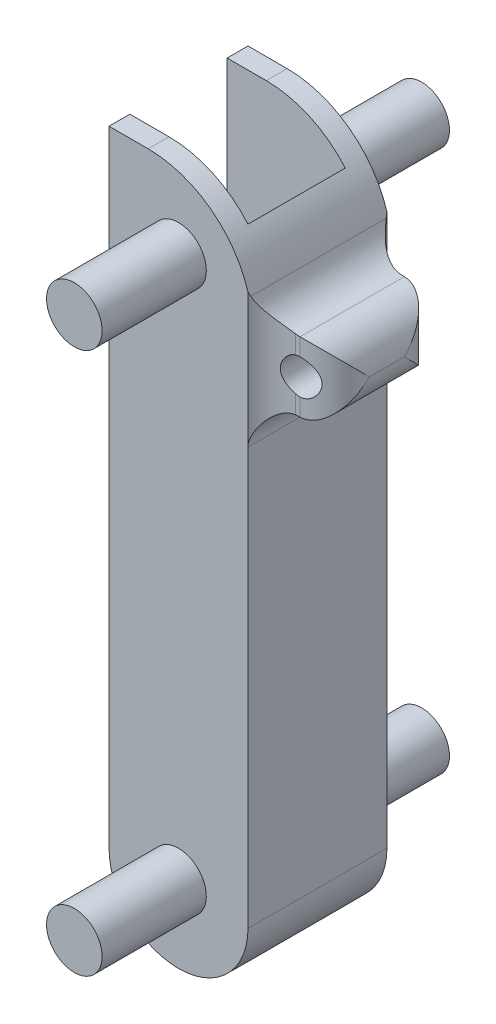
from build123d import *

# Parameters (mm, degrees)
SKETCH1_W               = 20
SKETCH1_H               = 100
BOSS_EXTRUDE1_DEPTH     = 10
SKETCH3_R               = 4
BOSS_EXTRUDE2_DEPTH     = 25
FILLET1_R               = 10
SKETCH5_W               = 10
SKETCH5_H               = 10
SKETCH5_R               = 2.5
BOSS_EXTRUDE3_DEPTH     = 7.5
FILLET2_R               = 5
CUT_EXTRUDE1_DEPTH      = 106.000000019
CUT_EXTRUDE1_DEPTH_BACK = 106.000000019
SKETCH6_W               = 17
SKETCH6_H               = 14
FILLET3_R               = 15


# Some blends are built 0.0001 mm under size
with BuildPart() as part:
    # Sketch1 → Boss-Extrude1 (new, symmetric)
    with BuildSketch(Plane(origin=(0, 0, 0), x_dir=(0, 0, -1), z_dir=(1, 0, 0))):
        with Locations((0, 50)):
            Rectangle(SKETCH1_W, SKETCH1_H)
    extrude(amount=BOSS_EXTRUDE1_DEPTH, both=True)

    # Sketch3 → Boss-Extrude2 (add, symmetric)
    with BuildSketch(Plane.XY):
        with Locations(Location((0, 11, 0), (0, 0, 270))):
            Circle(SKETCH3_R)
        with Locations(Location((0, 89, 0), (0, 0, 270))):
            Circle(SKETCH3_R)
    extrude(amount=BOSS_EXTRUDE2_DEPTH, both=True)

    # Fillet1
    fillet1_edges = [part.edges().sort_by_distance(p)[0] for p in [
        (10, 0, 0),
        (-10, 0, 0),
    ]]
    fillet(fillet1_edges, radius=FILLET1_R - 0.0001)  # a hair under: the kernel refuses the full size

    # Sketch5 → Boss-Extrude3 (add, symmetric)
    with BuildSketch(Plane.XY):
        with Locations((15, 80)):
            Rectangle(SKETCH5_W, SKETCH5_H)
        with Locations((15, 80)):
            Circle(SKETCH5_R, mode=Mode.SUBTRACT)
    extrude(amount=BOSS_EXTRUDE3_DEPTH, both=True)

    # Fillet2
    # the kernel refuses this fillet: 5 mm, written as the material it takes off along each edge
    with BuildSketch(Plane(origin=(20, 97.5, 7.5), x_dir=(-1, 0, 0), z_dir=(0, -1, 0))) as fillet2_piece_1:
        with BuildLine():
            CenterArc((FILLET2_R, FILLET2_R), FILLET2_R, 180, 90)
            Line((0, FILLET2_R), (0, 0))
            Line((0, 0), (FILLET2_R, 0))
        make_face()
    extrude(amount=35, mode=Mode.SUBTRACT)
    with BuildSketch(Plane(origin=(20, 97.5, -7.5), x_dir=(-1, 0, 0), z_dir=(0, -1, 0))) as fillet2_piece_2:
        with BuildLine():
            CenterArc((FILLET2_R, -FILLET2_R), FILLET2_R, 90, 90)
            Line((0, -FILLET2_R), (0, 0))
            Line((0, 0), (FILLET2_R, 0))
        make_face()
    extrude(amount=35, mode=Mode.SUBTRACT)
    with BuildSketch(Plane(origin=(20, 75, 20), x_dir=(-1, 0, 0), z_dir=(0, 0, -1))) as fillet2_piece_3:
        with BuildLine():
            CenterArc((FILLET2_R, FILLET2_R), FILLET2_R, 180, 90)
            Line((0, FILLET2_R), (0, 0))
            Line((0, 0), (FILLET2_R, 0))
        make_face()
    extrude(amount=40, mode=Mode.SUBTRACT)
    with BuildSketch(Plane(origin=(20, 85, 20), x_dir=(-1, 0, 0), z_dir=(0, 0, -1))) as fillet2_piece_4:
        with BuildLine():
            CenterArc((FILLET2_R, -FILLET2_R), FILLET2_R, 90, 90)
            Line((0, -FILLET2_R), (0, 0))
            Line((0, 0), (FILLET2_R, 0))
        make_face()
    extrude(amount=40, mode=Mode.SUBTRACT)
    # the kernel refuses this fillet: 5 mm, written as the material it adds along each edge
    with BuildSketch(Plane(origin=(10, 75, 7.5), x_dir=(0, 0, 1), z_dir=(0, 1, 0))) as fillet2_2_piece_1_section:
        with BuildLine():
            CenterArc((5, 4.330127019), FILLET2_R, 180, 60)
            Line((0, 4.330127019), (0, 0))
            Line((0, 0), (2.5, 0))
        make_face()
    fillet2_2_piece_1 = extrude(amount=10, mode=Mode.PRIVATE)
    fillet2_2_piece_1 = fillet2_2_piece_1 - Plane(origin=(15, 80, 7.5), x_dir=(1, 0, 0), z_dir=(0, 0, -1)) * Cylinder(2.5, 38, mode=Mode.PRIVATE)
    add(fillet2_2_piece_1)
    with BuildSketch(Plane(origin=(10, 75, -7.5), x_dir=(0, 0, -1), z_dir=(0, 1, 0))) as fillet2_2_piece_2_section:
        with BuildLine():
            CenterArc((5, -4.330127019), FILLET2_R, 120, 60)
            Line((0, -4.330127019), (0, 0))
            Line((0, 0), (2.5, 0))
        make_face()
    fillet2_2_piece_2 = extrude(amount=10, mode=Mode.PRIVATE)
    fillet2_2_piece_2 = fillet2_2_piece_2 - Plane(origin=(15, 80, -7.5), x_dir=(1, 0, 0), z_dir=(0, 0, -1)) * Cylinder(2.5, 38, mode=Mode.PRIVATE)
    add(fillet2_2_piece_2)
    with BuildSketch(Plane(origin=(10, 85, -7.5), x_dir=(0, 1, 0), z_dir=(0, 0, 1))) as fillet2_2_piece_3:
        with BuildLine():
            CenterArc((FILLET2_R, -FILLET2_R), FILLET2_R, 90, 90)
            Line((0, -FILLET2_R), (0, 0))
            Line((0, 0), (FILLET2_R, 0))
        make_face()
    extrude(amount=15)
    with BuildSketch(Plane(origin=(10, 75, -7.5), x_dir=(0, -1, 0), z_dir=(0, 0, 1))) as fillet2_2_piece_4:
        with BuildLine():
            CenterArc((FILLET2_R, FILLET2_R), FILLET2_R, 180, 90)
            Line((0, FILLET2_R), (0, 0))
            Line((0, 0), (FILLET2_R, 0))
        make_face()
    extrude(amount=15)
    with BuildSketch(Plane(origin=(10, 64.174682453, 7.5), x_dir=(0, 0, 1), z_dir=(0, 1, 0))) as fillet2_2_piece_5a_section:
        with BuildLine():
            CenterArc((5, 4.330127019), FILLET2_R, 180, 60)
            Line((0, 4.330127019), (0, 0))
            Line((0, 0), (2.5, 0))
        make_face()
    fillet2_2_piece_5a = extrude(amount=20.825317547, mode=Mode.PRIVATE)
    fillet2_2_piece_5a = split(fillet2_2_piece_5a, bisect_by=Plane(origin=(10, 75, 7.5), z_dir=(0, -1, 0)), keep=Keep.TOP, mode=Mode.PRIVATE)
    with BuildSketch(Plane(origin=(10, 75, -7.5), x_dir=(0, -1, 0), z_dir=(0, 0, 1))) as fillet2_2_piece_5b_section:
        with BuildLine():
            CenterArc((FILLET2_R, FILLET2_R), FILLET2_R, 180, 90)
            Line((0, FILLET2_R), (0, 0))
            Line((0, 0), (FILLET2_R, 0))
        make_face()
    fillet2_2_piece_5b = extrude(amount=27.5, mode=Mode.PRIVATE)
    fillet2_2_piece_5b = split(fillet2_2_piece_5b, bisect_by=Plane(origin=(10, 75, 10), z_dir=(0, 0, -1)), keep=Keep.TOP, mode=Mode.PRIVATE)
    fillet2_2_piece_5b = split(fillet2_2_piece_5b, bisect_by=Plane(origin=(10, 75, 7.5), z_dir=(0, 0, 1)), keep=Keep.TOP, mode=Mode.PRIVATE)
    fillet2_2_piece_5 = fillet2_2_piece_5a & fillet2_2_piece_5b
    add(fillet2_2_piece_5)
    with BuildSketch(Plane(origin=(10, 85, -7.5), x_dir=(0, 1, 0), z_dir=(0, 0, 1))) as fillet2_2_piece_6a_section:
        with BuildLine():
            CenterArc((FILLET2_R, -FILLET2_R), FILLET2_R, 90, 90)
            Line((0, -FILLET2_R), (0, 0))
            Line((0, 0), (FILLET2_R, 0))
        make_face()
    fillet2_2_piece_6a = extrude(amount=27.5, mode=Mode.PRIVATE)
    fillet2_2_piece_6a = split(fillet2_2_piece_6a, bisect_by=Plane(origin=(10, 85, 10), z_dir=(0, 0, -1)), keep=Keep.TOP, mode=Mode.PRIVATE)
    fillet2_2_piece_6a = split(fillet2_2_piece_6a, bisect_by=Plane(origin=(10, 85, 7.5), z_dir=(0, 0, 1)), keep=Keep.TOP, mode=Mode.PRIVATE)
    with BuildSketch(Plane(origin=(10, 75, 7.5), x_dir=(0, 0, 1), z_dir=(0, 1, 0))) as fillet2_2_piece_6b_section:
        with BuildLine():
            CenterArc((5, 4.330127019), FILLET2_R, 180, 60)
            Line((0, 4.330127019), (0, 0))
            Line((0, 0), (2.5, 0))
        make_face()
    fillet2_2_piece_6b = extrude(amount=20.825317547, mode=Mode.PRIVATE)
    fillet2_2_piece_6b = split(fillet2_2_piece_6b, bisect_by=Plane(origin=(10, 85, 7.5), z_dir=(0, 1, 0)), keep=Keep.TOP, mode=Mode.PRIVATE)
    fillet2_2_piece_6 = fillet2_2_piece_6a & fillet2_2_piece_6b
    add(fillet2_2_piece_6)
    with BuildSketch(Plane(origin=(10, 75, -20), x_dir=(0, -1, 0), z_dir=(0, 0, 1))) as fillet2_2_piece_7a_section:
        with BuildLine():
            CenterArc((FILLET2_R, FILLET2_R), FILLET2_R, 180, 90)
            Line((0, FILLET2_R), (0, 0))
            Line((0, 0), (FILLET2_R, 0))
        make_face()
    fillet2_2_piece_7a = extrude(amount=27.5, mode=Mode.PRIVATE)
    fillet2_2_piece_7a = split(fillet2_2_piece_7a, bisect_by=Plane(origin=(10, 75, -10), z_dir=(0, 0, 1)), keep=Keep.TOP, mode=Mode.PRIVATE)
    fillet2_2_piece_7a = split(fillet2_2_piece_7a, bisect_by=Plane(origin=(10, 75, -7.5), z_dir=(0, 0, -1)), keep=Keep.TOP, mode=Mode.PRIVATE)
    with BuildSketch(Plane(origin=(10, 64.174682453, -7.5), x_dir=(0, 0, -1), z_dir=(0, 1, 0))) as fillet2_2_piece_7b_section:
        with BuildLine():
            CenterArc((5, -4.330127019), FILLET2_R, 120, 60)
            Line((0, -4.330127019), (0, 0))
            Line((0, 0), (2.5, 0))
        make_face()
    fillet2_2_piece_7b = extrude(amount=20.825317547, mode=Mode.PRIVATE)
    fillet2_2_piece_7b = split(fillet2_2_piece_7b, bisect_by=Plane(origin=(10, 75, -7.5), z_dir=(0, -1, 0)), keep=Keep.TOP, mode=Mode.PRIVATE)
    fillet2_2_piece_7 = fillet2_2_piece_7a & fillet2_2_piece_7b
    add(fillet2_2_piece_7)
    with BuildSketch(Plane(origin=(10, 85, -20), x_dir=(0, 1, 0), z_dir=(0, 0, 1))) as fillet2_2_piece_8a_section:
        with BuildLine():
            CenterArc((FILLET2_R, -FILLET2_R), FILLET2_R, 90, 90)
            Line((0, -FILLET2_R), (0, 0))
            Line((0, 0), (FILLET2_R, 0))
        make_face()
    fillet2_2_piece_8a = extrude(amount=27.5, mode=Mode.PRIVATE)
    fillet2_2_piece_8a = split(fillet2_2_piece_8a, bisect_by=Plane(origin=(10, 85, -10), z_dir=(0, 0, 1)), keep=Keep.TOP, mode=Mode.PRIVATE)
    fillet2_2_piece_8a = split(fillet2_2_piece_8a, bisect_by=Plane(origin=(10, 85, -7.5), z_dir=(0, 0, -1)), keep=Keep.TOP, mode=Mode.PRIVATE)
    with BuildSketch(Plane(origin=(10, 75, -7.5), x_dir=(0, 0, -1), z_dir=(0, 1, 0))) as fillet2_2_piece_8b_section:
        with BuildLine():
            CenterArc((5, -4.330127019), FILLET2_R, 120, 60)
            Line((0, -4.330127019), (0, 0))
            Line((0, 0), (2.5, 0))
        make_face()
    fillet2_2_piece_8b = extrude(amount=20.825317547, mode=Mode.PRIVATE)
    fillet2_2_piece_8b = split(fillet2_2_piece_8b, bisect_by=Plane(origin=(10, 85, -7.5), z_dir=(0, 1, 0)), keep=Keep.TOP, mode=Mode.PRIVATE)
    fillet2_2_piece_8 = fillet2_2_piece_8a & fillet2_2_piece_8b
    add(fillet2_2_piece_8)

    # Sketch6 → Cut-Extrude1 (cut, two sides: drawn at the far end of the back side and taken through both)
    with BuildSketch(Plane(origin=(0, 100, 0), x_dir=(1, 0, 0), z_dir=(0, 1, 0)).offset(-CUT_EXTRUDE1_DEPTH_BACK)):
        with Locations((-1.5, 0)):
            Rectangle(SKETCH6_W, SKETCH6_H)
    extrude(amount=CUT_EXTRUDE1_DEPTH + CUT_EXTRUDE1_DEPTH_BACK, mode=Mode.SUBTRACT)

    # Fillet3
    # the kernel refuses this fillet: 15 mm, written as the material it takes off along each edge
    with BuildSketch(Plane(origin=(10, 100, -45.912291828), x_dir=(0.014111556263048879, -0.9999004270325296, 0), z_dir=(0, 0, 1))) as fillet3_piece_1:
        with BuildLine():
            CenterArc((14.795795075, -14.575159718), FILLET3_R, 103.668952733, 75.522487814)
            Line((-0.202711331, -14.363486374), (-1.702561971, -14.342319039))
            Line((-1.702561971, -14.342319039), (-1.499850641, 0.021167334))
            Line((-1.499850641, 0.021167334), (0.021167334, 1.499850641))
            ThreePointArc((0.021167334, 1.499850641), (10.020171605, 1.358735078), (10.896652831, 1.457515972))
            Line((10.896652831, 1.457515972), (11.251120307, 0))
        make_face()
    extrude(amount=91.824583655, mode=Mode.SUBTRACT)


solid = part.part
